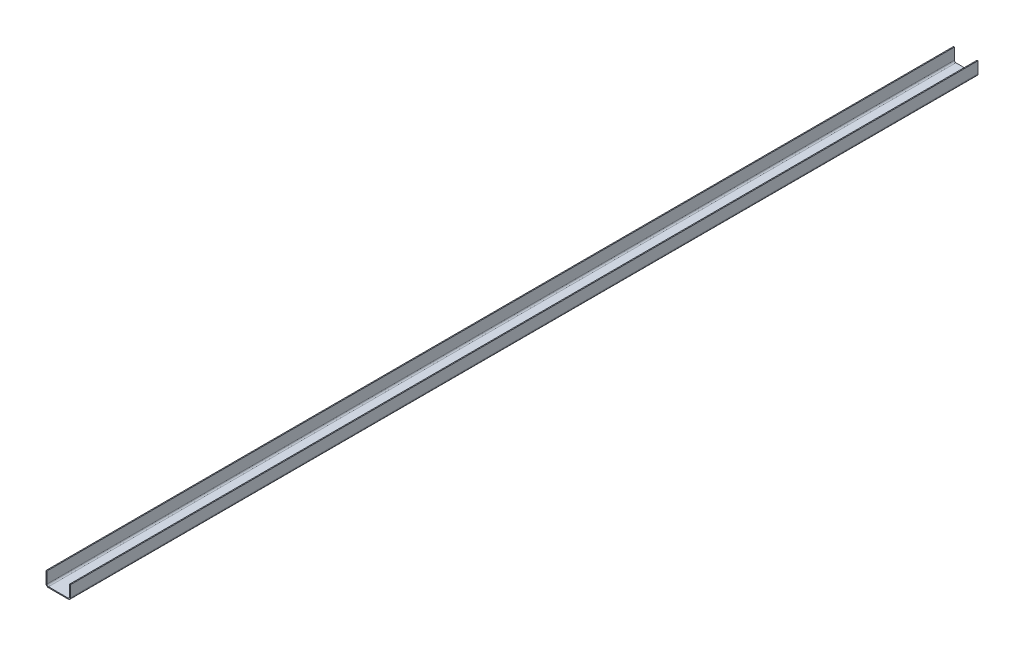
from build123d import *

# Parameters (mm, degrees)
BASE_FLANGE1_DEPTH = 1200


# Sheet-metal steps are written as plain solids
with BuildPart() as part:
    # Sketch1 → Base-Flange1 (new body)
    with BuildSketch(Plane.XY):
        with BuildLine():
            Line((0, 17), (0, 2))
            ThreePointArc((0, 2), (0.585786438, 0.585786438), (2, 0))
            Line((2, 0), (28, 0))
            ThreePointArc((28, 0), (29.414213562, 0.585786438), (30, 2))
            Line((30, 2), (30, 17))
            Line((30, 17), (31.25, 17))
            Line((31.25, 17), (31.25, 2))
            ThreePointArc((31.25, 2), (30.298097039, -0.298097039), (28, -1.25))
            Line((28, -1.25), (2, -1.25))
            ThreePointArc((2, -1.25), (-0.298097039, -0.298097039), (-1.25, 2))
            Line((-1.25, 2), (-1.25, 17))
            Line((-1.25, 17), (0, 17))
        make_face()
    extrude(amount=BASE_FLANGE1_DEPTH)


solid = part.part
